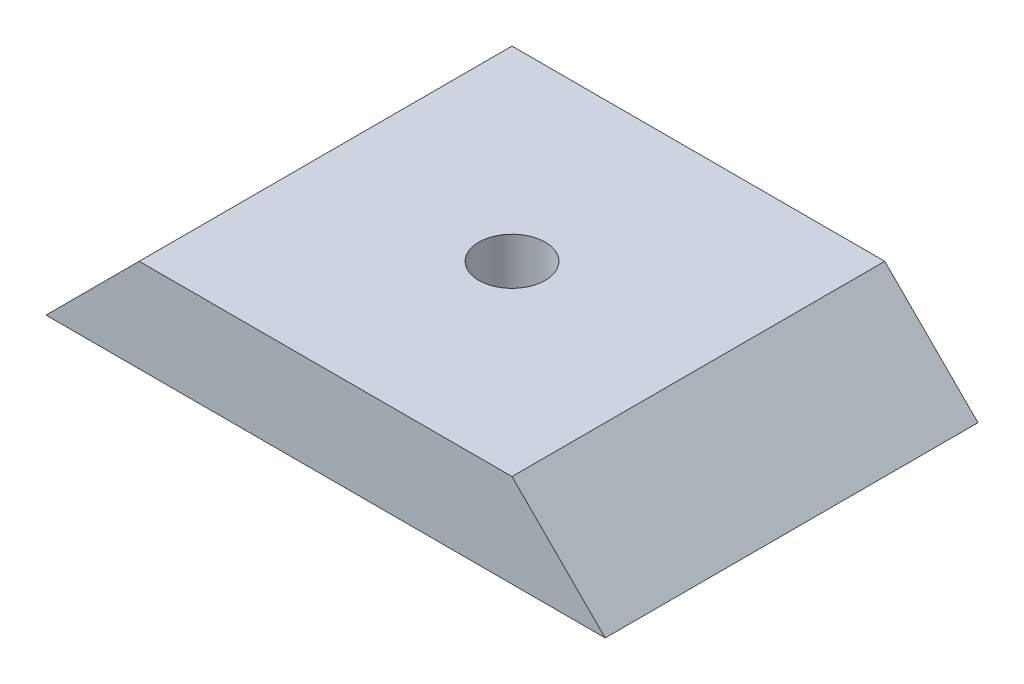
from build123d import *

# Parameters (mm, degrees)
SKETCH1_W                 = 19.05
SKETCH1_H                 = 12.7
BOSS_EXTRUDE1_DEPTH       = 3.175
CHAMFER1_SIZE             = 3.175
TAP_DRILL_FOR_4_40_TAP1_D = 2.2606


with BuildPart() as part:
    # Sketch1 → Boss-Extrude1 (new body)
    with BuildSketch(Plane(origin=(0, 0, 0), x_dir=(1, 0, 0), z_dir=(0, 1, 0))):
        with Locations((9.525, 6.35)):
            Rectangle(SKETCH1_W, SKETCH1_H)
    extrude(amount=BOSS_EXTRUDE1_DEPTH)

    # Chamfer1
    chamfer1_edges = [part.edges().sort_by_distance(p)[0] for p in [
        (19.05, 3.175, -6.35),
        (0, 3.175, -6.35),
    ]]
    chamfer(chamfer1_edges, length=CHAMFER1_SIZE - 0.0001)  # a hair under: the kernel refuses the full size

    # Tap Drill for #4-40 Tap1 (through all)
    with Locations(Plane(origin=(0, 0, 0), x_dir=(-1, 0, 0), z_dir=(0, -1, 0))):
        with Locations((-9.525, 6.35)):
            Hole(TAP_DRILL_FOR_4_40_TAP1_D / 2)


solid = part.part
